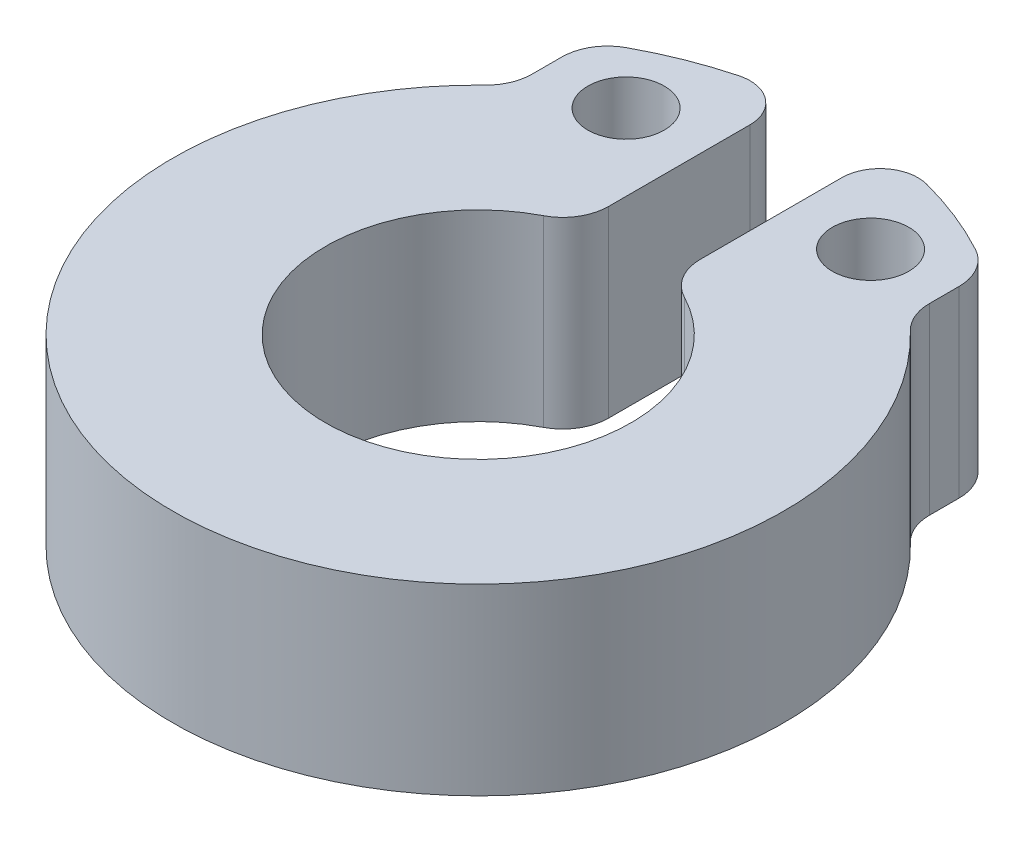
from build123d import *

# Parameters (mm, degrees)
SKETCH1_R           = 0.25
BOSS_EXTRUDE1_DEPTH = 1.2
FILLET1_R           = 0.3
FILLET2_R           = 0.25


with BuildPart() as part:
    # Sketch1 → Boss-Extrude1 (new body)
    with BuildSketch(Plane(origin=(0, 0, 0), x_dir=(1, 0, 0), z_dir=(0, 1, 0))):
        with BuildLine():
            Line((-0.3, 0.953939201), (-0.3, 2.38117618))
            ThreePointArc((-0.3, 2.38117618), (-0.820413855, 2.255420383), (-1.3, 2.0174241))
            Line((-1.3, 2.0174241), (-1.3, 1.519868415))
            ThreePointArc((-1.3, 1.519868415), (0, -2), (1.3, 1.519868415))
            Line((1.3, 1.519868415), (1.3, 2.0174241))
            ThreePointArc((1.3, 2.0174241), (0.820413855, 2.255420383), (0.3, 2.38117618))
            Line((0.3, 2.38117618), (0.3, 0.953939201))
            ThreePointArc((0.3, 0.953939201), (0, -1), (-0.3, 0.953939201))
        make_face()
        with Locations((-0.8, 1.7674241)):
            Circle(SKETCH1_R, mode=Mode.SUBTRACT)
        with Locations((0.8, 1.7674241)):
            Circle(SKETCH1_R, mode=Mode.SUBTRACT)
    extrude(amount=BOSS_EXTRUDE1_DEPTH)

    # Fillet1
    fillet1_edges = [part.edges().sort_by_distance(p)[0] for p in [
        (-1.3, 0.6, -2.0174241),
        (1.3, 0.6, -2.0174241),
        (1.3, 0.6, -1.519868415),
        (-1.3, 0.6, -1.519868415),
        (0.3, 0.6, -0.953939201),
        (-0.3, 0.6, -0.953939201),
    ]]
    fillet(fillet1_edges, radius=FILLET1_R)

    # Fillet2
    fillet2_edges = [part.edges().sort_by_distance(p)[0] for p in [
        (0.3, 0.6, -2.38117618),
        (-0.3, 0.6, -2.38117618),
    ]]
    fillet(fillet2_edges, radius=FILLET2_R)


solid = part.part
